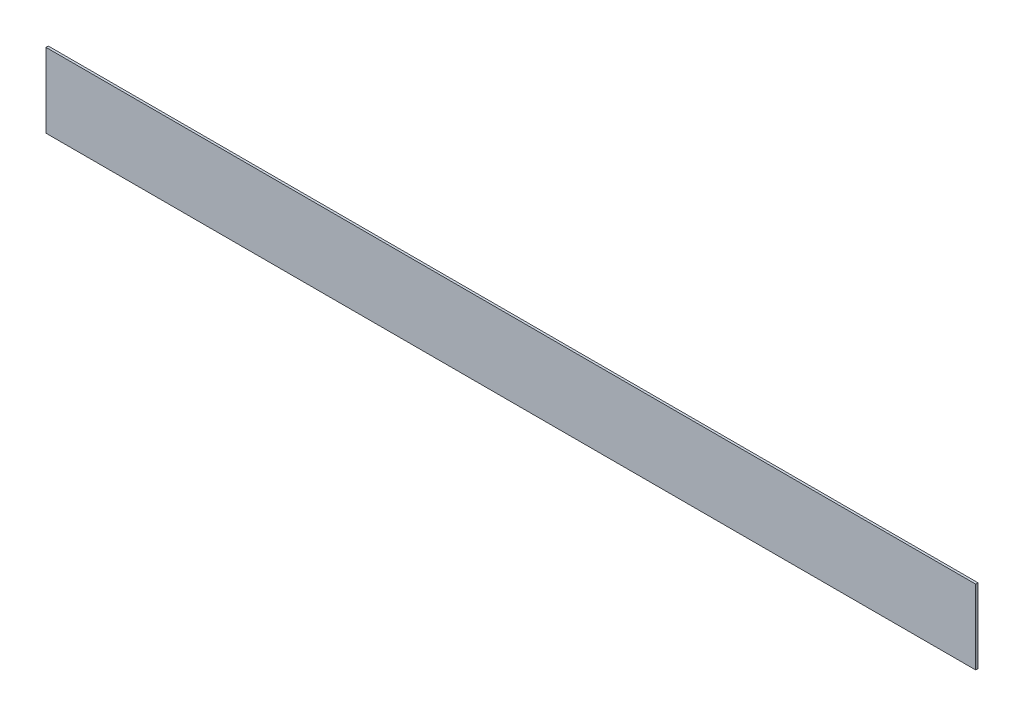
from build123d import *

# Parameters (mm, degrees)
SKETCH1_W           = 635
SKETCH1_H           = 50.8
BOSS_EXTRUDE1_DEPTH = 1.5875


with BuildPart() as part:
    # Sketch1 → Boss-Extrude1 (new body)
    with BuildSketch(Plane.XY):
        with Locations((317.5, 25.4)):
            Rectangle(SKETCH1_W, SKETCH1_H)
    extrude(amount=BOSS_EXTRUDE1_DEPTH)


solid = part.part
